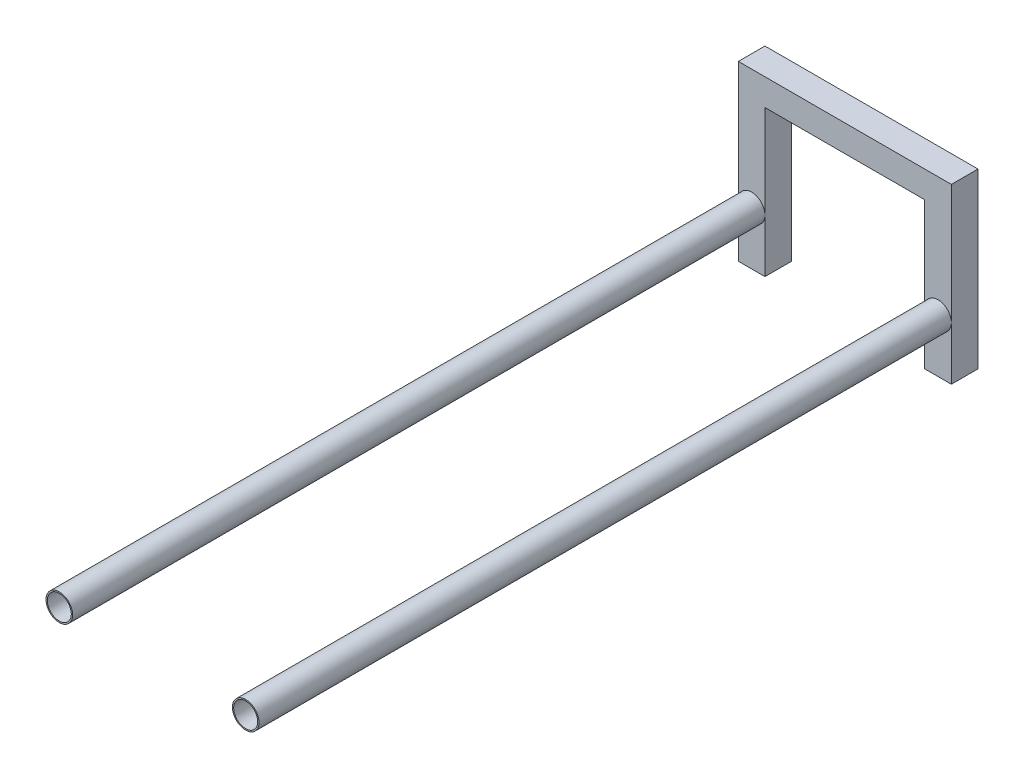
from build123d import *

# Parameters (mm, degrees)
SKETCH1_R             = 12.7
SKETCH1_R_2           = 11.4554
BOSS_EXTRUDE1_DEPTH   = 660.4
BOSS_EXTRUDE1_2_DEPTH = 660.4
BOSS_EXTRUDE2_DEPTH   = 25.4
SHELL1_START          = -24.1554
SHELL1_DEPTH          = 22.9108


# Read off the part's stored shape, not the designer's step: Shell1
with BuildPart() as part:
    # Sketch1 → Boss-Extrude1 (new body)
    with BuildSketch(Plane.XY):
        with Locations((-88.9, 0)):
            Circle(SKETCH1_R)
        with Locations((-88.9, 0)):
            Circle(SKETCH1_R_2, mode=Mode.SUBTRACT)
    extrude(amount=BOSS_EXTRUDE1_DEPTH)



with BuildPart() as body_2:
    # Sketch1 → Boss-Extrude1 2 (new body)
    with BuildSketch(Plane.XY):
        with Locations(Location((88.9, 0, 0), (0, 0, 180))):
            Circle(SKETCH1_R)
        with Locations(Location((88.9, 0, 0), (0, 0, 180))):
            Circle(SKETCH1_R_2, mode=Mode.SUBTRACT)
    extrude(amount=BOSS_EXTRUDE1_2_DEPTH)


with BuildPart() as part_1:
    add(part.part)

    add(body_2.part)  # Boss-Extrude2 merges body 2
    # Sketch2 → Boss-Extrude2 (add)
    with BuildSketch(Plane(origin=(0, 0, 0), x_dir=(-1, 0, 0), z_dir=(0, 0, -1))):
        Polygon((101.6, 0), (101.6, 114.3), (-101.6, 114.3), (-101.6, 0), (-101.6, -50.8), (-76.2, -50.8), (-76.2, 0), (-76.2, 88.9), (76.2, 88.9), (76.2, 0), (76.2, -50.8), (101.6, -50.8), align=None)
    extrude(amount=BOSS_EXTRUDE2_DEPTH)

    # Shell1 outline → Shell1 (cut)
    with BuildSketch(Plane.XY.offset(SHELL1_START)):
        Polygon((-100.3554, 113.0554), (-100.3554, -50.8), (-77.4446, -50.8), (-77.4446, 90.1446), (77.4446, 90.1446), (77.4446, -50.8), (100.3554, -50.8), (100.3554, 113.0554), align=None)
    extrude(amount=SHELL1_DEPTH, mode=Mode.SUBTRACT)


solid = part_1.part
